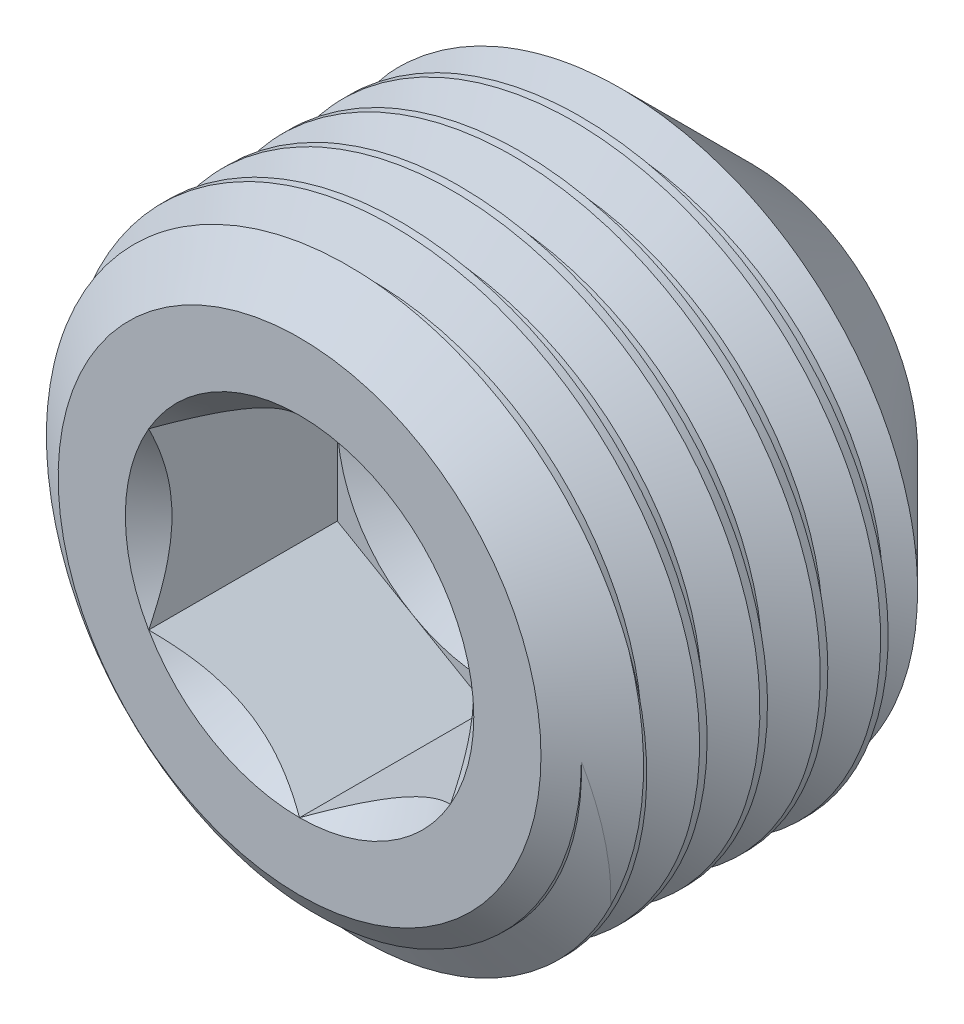
from build123d import *

# Parameters (mm, degrees)
CUT_SWEEP2_PITCH    = 1.27
CUT_EXTRUDE10_DEPTH = 3.96875


with BuildPart() as part:
    # Sketch22 → Revolve1 (revolve)
    with BuildSketch(Plane(origin=(0, 0, 0), x_dir=(0, 0, -1), z_dir=(1, 0, 0)), mode=Mode.PRIVATE) as revolve1_sk:
        Polygon((-3.717129558, 0), (-3.717129558, 5.08), (-2.827865985, 6.35), (2.937447597, 6.35), (5.807870442, 3.479577155), (3.717129558, 0), align=None)
    revolve(revolve1_sk.sketch.rotate(Axis((0, 0, -3.717129558), (0, 0, -1)), 180), axis=Axis((0, 0, -3.717129558), (0, 0, -1)))

    # Cut-Sweep2: the profile of Sketch28 profile screwed along a right-hand helix of 8.808 turns, 8 arcs to a turn; built about Z, then put on its axis
    cut_sweep2_z = Axis((0, 0, 0), (0, 0, 1))
    cut_sweep2_corners = [(0, 6.3503, 0.000173205), (0, 6.3503, -1.111423205), (0, 5.580103416, -0.66675), (0, 5.580103416, -0.4445)]
    with BuildLine(mode=Mode.PRIVATE) as cut_sweep2_profile:
        Line(cut_sweep2_corners[0], cut_sweep2_corners[1])
        Line(cut_sweep2_corners[1], cut_sweep2_corners[2])
        Line(cut_sweep2_corners[2], cut_sweep2_corners[3])
        Line(cut_sweep2_corners[3], cut_sweep2_corners[0])
    cut_sweep2_cap = Face(cut_sweep2_profile.wire())
    cut_sweep2_turn_angles = [0, 22.5, 45, 67.5, 90, 112.5, 135, 157.5, 180, 202.5, 225, 247.5, 270, 292.5, 315, 337.5, 360]
    cut_sweep2_turn_weights = [1, 0.9238795325112867, 1, 0.9238795325112867, 1, 0.9238795325112867, 1, 0.9238795325112867, 1, 0.9238795325112867, 1, 0.9238795325112867, 1, 0.9238795325112867, 1, 0.9238795325112867, 1]
    cut_sweep2_turn_rails = [Edge.make_bspline([Vector(p[0], p[1], 0).rotate(cut_sweep2_z, cut_sweep2_turn_angles[k]) / cut_sweep2_turn_weights[k] + Vector(0, 0, p[2] + CUT_SWEEP2_PITCH * cut_sweep2_turn_angles[k] / 360) for k in range(17)], [0, 0, 0, 1, 1, 2, 2, 3, 3, 4, 4, 5, 5, 6, 6, 7, 7, 8, 8, 8], 2, cut_sweep2_turn_weights) for p in cut_sweep2_corners]
    cut_sweep2_turn_sides = [Face.make_surface_from_curves(cut_sweep2_turn_rails[p[0]], cut_sweep2_turn_rails[p[1]]) for p in [(0, 1), (1, 2), (2, 3), (3, 0)]]
    cut_sweep2_last_angles = [2880, 2902.5, 2925, 2947.5, 2970, 2992.5, 3015, 3037.5, 3060, 3082.5, 3105, 3127.5, 3150, 3160.44, 3170.88]
    cut_sweep2_last_weights = [1, 0.9238795325112867, 1, 0.9238795325112867, 1, 0.9238795325112867, 1, 0.9238795325112867, 1, 0.9238795325112867, 1, 0.9238795325112867, 1, 0.983445204995326, 1]
    cut_sweep2_last_rails = [Edge.make_bspline([Vector(p[0], p[1], 0).rotate(cut_sweep2_z, cut_sweep2_last_angles[k]) / cut_sweep2_last_weights[k] + Vector(0, 0, p[2] + CUT_SWEEP2_PITCH * cut_sweep2_last_angles[k] / 360) for k in range(15)], [0, 0, 0, 1, 1, 2, 2, 3, 3, 4, 4, 5, 5, 6, 6, 7, 7, 7], 2, cut_sweep2_last_weights) for p in cut_sweep2_corners]
    cut_sweep2_last_sides = [Face.make_surface_from_curves(cut_sweep2_last_rails[p[0]], cut_sweep2_last_rails[p[1]]) for p in [(0, 1), (1, 2), (2, 3), (3, 0)]]
    cut_sweep2 = Plane(origin=(0, 0, -5.807870442), x_dir=(1, 0, 0), z_dir=(0, 0, 1)) * Solid(Shell([*[p.moved(Location((0, 0, CUT_SWEEP2_PITCH * i))) for i in range(8) for p in cut_sweep2_turn_sides], *cut_sweep2_last_sides, cut_sweep2_cap, cut_sweep2_cap.rotate(cut_sweep2_z, 3170.88).moved(Location((0, 0, CUT_SWEEP2_PITCH * 3170.88 / 360)))]))
    add(cut_sweep2, mode=Mode.SUBTRACT)

    # Sketch23 → Cut-Extrude10 (cut)
    with BuildSketch(Plane.XY.offset(3.717129558)):
        Polygon((0, 3.666174209), (-3.175, 1.833087105), (-3.175, -1.833087105), (0, -3.666174209), (3.175, -1.833087105), (3.175, 1.833087105), align=None)
    extrude(amount=-CUT_EXTRUDE10_DEPTH, mode=Mode.SUBTRACT)

    # Cut-Extrude11 cone 1 section (through the dimple's axis) → Cut-Extrude11 (revolve, cut)
    with BuildSketch(Plane(origin=(0, 0, 3.717129558), x_dir=(0, -1, 0), z_dir=(1, 0, 0))):
        Polygon((0, 0), (3.666174209, 0), (0, 3.666174209), align=None)
    revolve(axis=Axis((0, 0, 3.717129558), (0, 0, -1)), mode=Mode.SUBTRACT)

    # Cut-Extrude12 cone 1 section (through the dimple's axis) → Cut-Extrude12 (revolve, cut)
    with BuildSketch(Plane(origin=(0, 0, -0.251620442), x_dir=(0, -1, 0), z_dir=(1, 0, 0))):
        Polygon((0, 0), (3.175, 0), (0, 1.833087105), align=None)
    revolve(axis=Axis((0, 0, -0.251620442), (0, 0, -1)), mode=Mode.SUBTRACT)


solid = part.part
